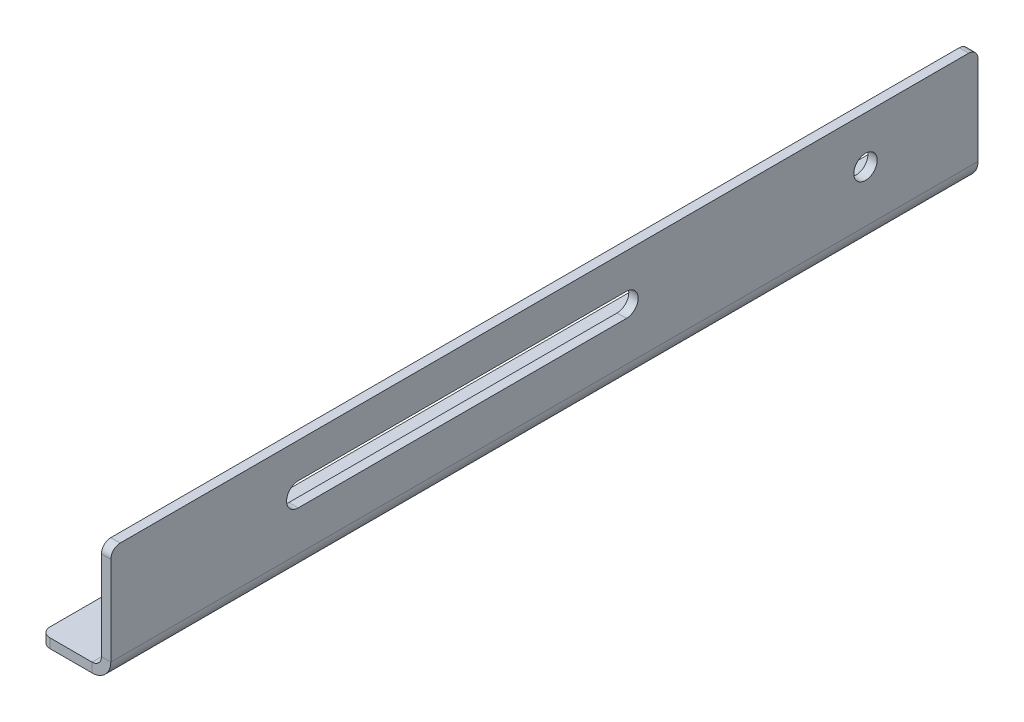
from build123d import *

# Parameters (mm, degrees)
BOSS_EXTRUDE1_DEPTH    = 370
CUT_EXTRUDE1_REACH     = 376.267
SKETCH4_R              = 5
CUT_EXTRUDE2_DEPTH     = 375.566416007
SKETCH5_R              = 2.5
CUT_EXTRUDE3_DEPTH     = 375.566416007
SKETCH6_R              = 2.5
CUT_EXTRUDE4_DEPTH     = 375.566416007
CONVERT_SOLID1_DEPTH   = 370
CONVERT_SOLID1_2_DEPTH = 370
FILLET1_R              = 4


# Read off the part's stored shape, not the designer's step: Convert-Solid1
with BuildPart() as part:
    # Sketch1 → Boss-Extrude1 (new body)
    with BuildSketch(Plane.XY):
        Polygon((0, 0), (0, 4), (26, 4), (26, 50), (30, 50), (30, 0), align=None)
    extrude(amount=BOSS_EXTRUDE1_DEPTH)

    # Sketch3 → Cut-Extrude1 (cut, up to next)
    with BuildSketch(Plane.ZY.offset(-26), mode=Mode.PRIVATE) as cut_extrude1_sk1:
        with BuildLine():
            Line((150, 35), (290, 35))
            ThreePointArc((290, 35), (295, 30), (290, 25))
            Line((290, 25), (150, 25))
            ThreePointArc((150, 25), (145, 30), (150, 35))
        make_face()
    cut_extrude1_tool1 = extrude(cut_extrude1_sk1.sketch, amount=-CUT_EXTRUDE1_REACH, mode=Mode.PRIVATE) & part.part
    add(cut_extrude1_tool1.solids().sort_by_distance((26, 30, 220))[0], mode=Mode.SUBTRACT)

    # Sketch4 → Cut-Extrude2 (cut, through all)
    with BuildSketch(Plane(origin=(30, 0, 0), x_dir=(0, 0, -1), z_dir=(1, 0, 0))):
        with Locations(Location((-48, 30, 0), (0, 0, 90))):
            Circle(SKETCH4_R)
    extrude(amount=-CUT_EXTRUDE2_DEPTH, mode=Mode.SUBTRACT)

    # Sketch5 → Cut-Extrude3 (cut, through all)
    with BuildSketch(Plane.XZ):
        with Locations((8.2, 27.7)):
            Circle(SKETCH5_R)
    extrude(amount=-CUT_EXTRUDE3_DEPTH, mode=Mode.SUBTRACT)

    # Sketch6 → Cut-Extrude4 (cut, through all)
    with BuildSketch(Plane.XZ):
        with Locations((8.2, 342.3)):
            Circle(SKETCH6_R)
    extrude(amount=-CUT_EXTRUDE4_DEPTH, mode=Mode.SUBTRACT)

    # Convert-Solid1 outline → Convert-Solid1 (cut)
    with BuildSketch(Plane.XY):
        with BuildLine():
            ThreePointArc((30, 8), (27.656854249, 2.343145751), (22, 0))
            Line((22, 0), (30, 0))
            Line((30, 0), (30, 8))
        make_face()
    extrude(amount=CONVERT_SOLID1_DEPTH, mode=Mode.SUBTRACT)

    # Convert-Solid1 2 outline → Convert-Solid1 2 (add)
    with BuildSketch(Plane.XY):
        with BuildLine():
            ThreePointArc((26, 8), (24.828427125, 5.171572875), (22, 4))
            Line((22, 4), (26, 4))
            Line((26, 4), (26, 8))
        make_face()
    extrude(amount=CONVERT_SOLID1_2_DEPTH)

    # Fillet1
    fillet1_edges = [part.edges().sort_by_distance(p)[0] for p in [
        (28, 50, 0),
        (28, 50, 370),
        (0, 2, 370),
        (0, 2, 0),
    ]]
    fillet(fillet1_edges, radius=FILLET1_R)


solid = part.part
